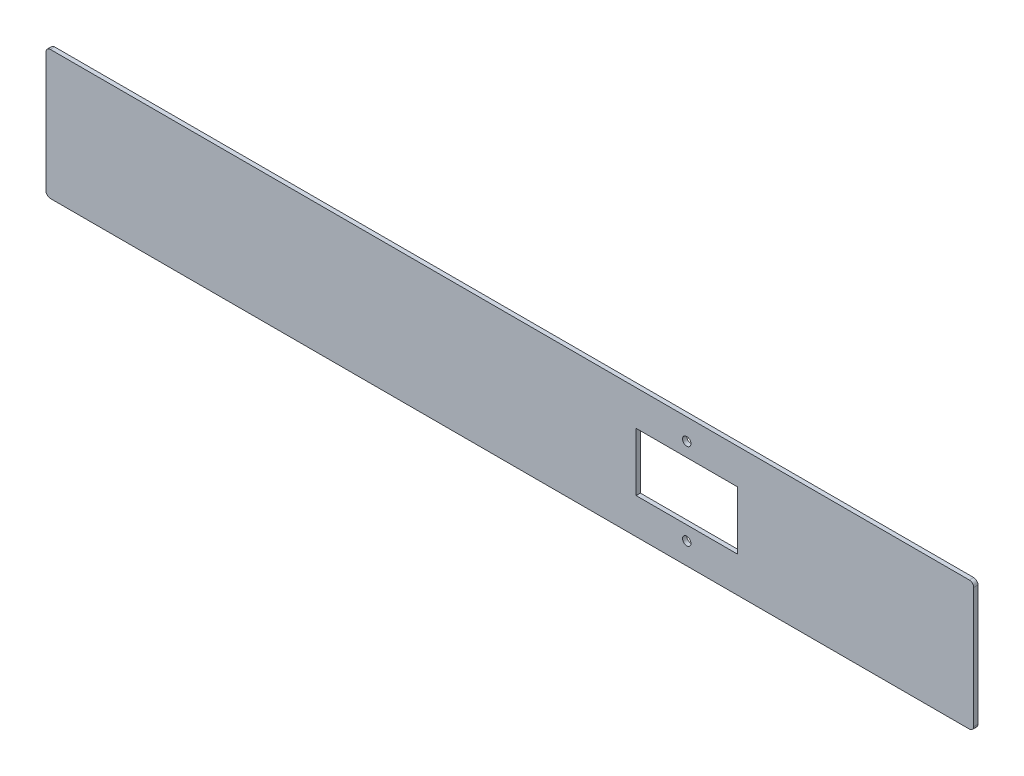
from build123d import *

# Parameters (mm, degrees)
SKETCH1_W           = 430
SKETCH1_H           = 59.85
SKETCH1_R           = 1.95
SKETCH1_W_2         = 47
SKETCH1_H_2         = 27
BOSS_EXTRUDE1_DEPTH = 2
FILLET1_R           = 2


with BuildPart() as part:
    # Sketch1 → Boss-Extrude1 (new body)
    with BuildSketch(Plane.XY):
        with Locations((-137.924811832, -4.371482412)):
            Rectangle(SKETCH1_W, SKETCH1_H)
        with Locations((-55.924811832, 15.703517588)):
            Circle(SKETCH1_R, mode=Mode.SUBTRACT)
        with Locations((-55.924811832, -24.296482412)):
            Circle(SKETCH1_R, mode=Mode.SUBTRACT)
        with Locations((-55.924811832, -4.296482412)):
            Rectangle(SKETCH1_W_2, SKETCH1_H_2, mode=Mode.SUBTRACT)
    extrude(amount=BOSS_EXTRUDE1_DEPTH)

    # Fillet1
    fillet1_edges = [part.edges().sort_by_distance(p)[0] for p in [
        (77.075188168, 25.553517588, 1),
        (77.075188168, -34.296482412, 1),
        (-352.924811832, -34.296482412, 1),
        (-352.924811832, 25.553517588, 1),
    ]]
    fillet(fillet1_edges, radius=FILLET1_R)


solid = part.part
